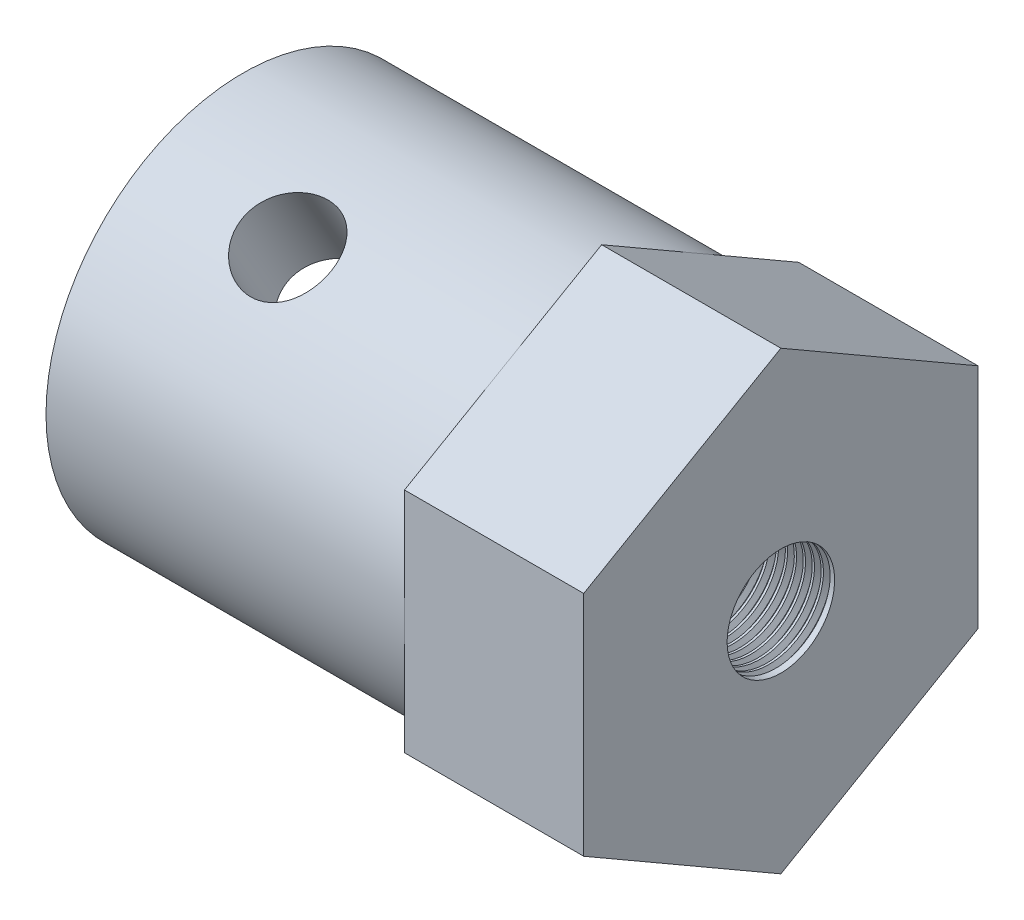
from build123d import *

# Parameters (mm, degrees)
SKETCH2_OUTSIDE_W         = 19.38
SKETCH2_OUTSIDE_H         = 19.38
CUT_EXTRUDE1_DEPTH        = 5
THREAD1_PITCH             = 0.25
M3X0_5_TAPPED_HOLE3_D     = 2.5
M3X0_5_TAPPED_HOLE3_DEPTH = 7.5
M3X0_5_TAPPED_HOLE3_TIP   = 0.751075774


with BuildPart() as part:
    # Sketch1 → Revolve1 (revolve)
    with BuildSketch(Plane.XY, mode=Mode.PRIVATE) as revolve1_sk:
        Polygon((-21.287690727, 1.5), (-21.287690727, 3), (-33.287690727, 3), (-33.287690727, 5.5), (-23.287690727, 5.5), (-23.287690727, 6.35), (-18.287690727, 6.35), (-18.287690727, 1.5), align=None)
    revolve(revolve1_sk.sketch.rotate(Axis((-36.642264211, 0, 0), (1, 0, 0)), 90), axis=Axis((-36.642264211, 0, 0), (1, 0, 0)))

    # Sketch2 outside → Cut-Extrude1 (cut)
    with BuildSketch(Plane(origin=(-18.287690727, 0, 0), x_dir=(0, 0, -1), z_dir=(1, 0, 0))):
        Rectangle(SKETCH2_OUTSIDE_W, SKETCH2_OUTSIDE_H)
        Polygon((0, 6.35), (-5.499261314, 3.175), (-5.499261314, -3.175), (0, -6.35), (5.499261314, -3.175), (5.499261314, 3.175), align=None, mode=Mode.SUBTRACT)
    extrude(amount=-CUT_EXTRUDE1_DEPTH, mode=Mode.SUBTRACT)

    # Thread1: the profile of Thread Profile1 profile screwed along a right-hand helix of 12 turns, 6 arcs to a turn; built about Z, then put on its axis
    thread1_z = Axis((0, 0, 0), (0, 0, 1))
    thread1_corners = [(1.4997, 0, -0.000173206), (1.635316469, 0, 0.078124999), (1.635316469, 0, 0.109374999), (1.4997, 0, 0.187673204)]
    with BuildLine(mode=Mode.PRIVATE) as thread1_profile:
        Line(thread1_corners[0], thread1_corners[1])
        Line(thread1_corners[1], thread1_corners[2])
        Line(thread1_corners[2], thread1_corners[3])
        Line(thread1_corners[3], thread1_corners[0])
    thread1_cap = Face(thread1_profile.wire())
    thread1_turn_angles = [0, 30, 60, 90, 120, 150, 180, 210, 240, 270, 300, 330, 360]
    thread1_turn_weights = [1, 0.8660254037844387, 1, 0.8660254037844387, 1, 0.8660254037844387, 1, 0.8660254037844387, 1, 0.8660254037844387, 1, 0.8660254037844387, 1]
    thread1_turn_rails = [Edge.make_bspline([Vector(p[0], p[1], 0).rotate(thread1_z, thread1_turn_angles[k]) / thread1_turn_weights[k] + Vector(0, 0, p[2] + THREAD1_PITCH * thread1_turn_angles[k] / 360) for k in range(13)], [0, 0, 0, 1, 1, 2, 2, 3, 3, 4, 4, 5, 5, 6, 6, 6], 2, thread1_turn_weights) for p in thread1_corners]
    thread1_turn_sides = [Face.make_surface_from_curves(thread1_turn_rails[p[0]], thread1_turn_rails[p[1]]) for p in [(0, 1), (1, 2), (2, 3), (3, 0)]]
    thread1 = Plane(origin=(-18.287690727, 0, 0), x_dir=(0, 0, 1), z_dir=(-1, 0, 0)) * Solid(Shell([*[p.moved(Location((0, 0, THREAD1_PITCH * i))) for i in range(12) for p in thread1_turn_sides], thread1_cap, thread1_cap.rotate(thread1_z, 4320).moved(Location((0, 0, THREAD1_PITCH * 4320 / 360)))]))
    add(thread1, mode=Mode.SUBTRACT)

    # M3x0.5 Tapped Hole3
    with Locations(Plane(origin=(0, 6.494550808, 3.749630657), x_dir=(1, 0, 0), z_dir=(0, 0.8660254037844379, 0.5000000000000011))):
        with Locations((-29.287690727, -0.040983934)):
            Hole(M3X0_5_TAPPED_HOLE3_D / 2, depth=M3X0_5_TAPPED_HOLE3_DEPTH)
            with Locations((0, 0, -(M3X0_5_TAPPED_HOLE3_DEPTH + M3X0_5_TAPPED_HOLE3_TIP / 2))):  # 118° drill point
                Cone(0, M3X0_5_TAPPED_HOLE3_D / 2, M3X0_5_TAPPED_HOLE3_TIP, mode=Mode.SUBTRACT)


solid = part.part
